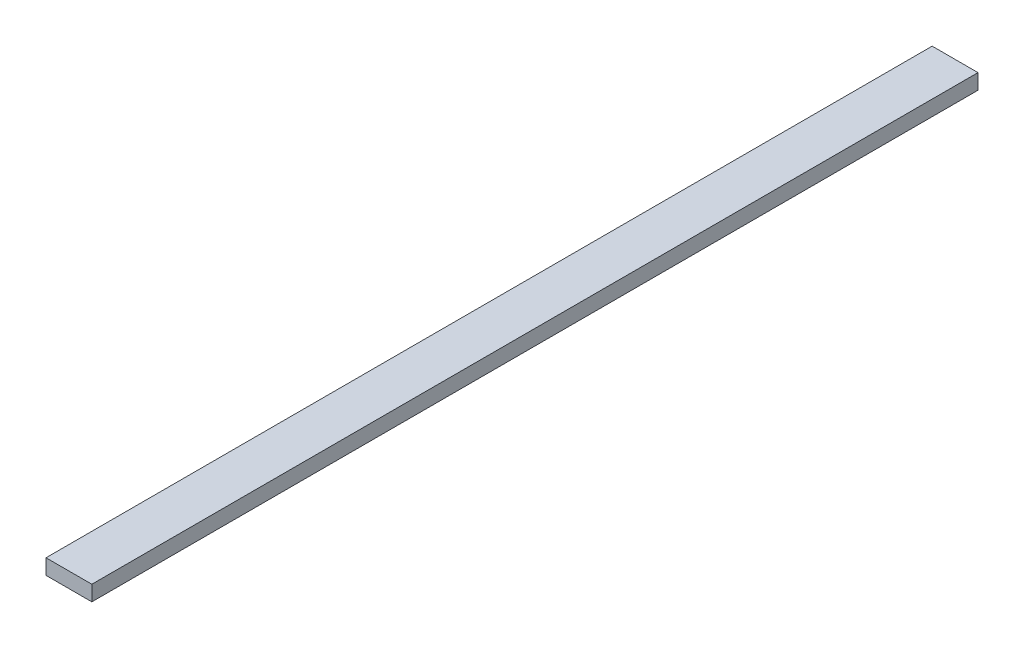
from build123d import *

# Parameters (mm, degrees)
SKETCH1_W           = 38.1
SKETCH1_H           = 12.7
BOSS_EXTRUDE1_DEPTH = 736.6


with BuildPart() as part:
    # Sketch1 → Boss-Extrude1 (new body)
    with BuildSketch(Plane.XY):
        with Locations((19.05, 6.35)):
            Rectangle(SKETCH1_W, SKETCH1_H)
    extrude(amount=BOSS_EXTRUDE1_DEPTH)


solid = part.part
